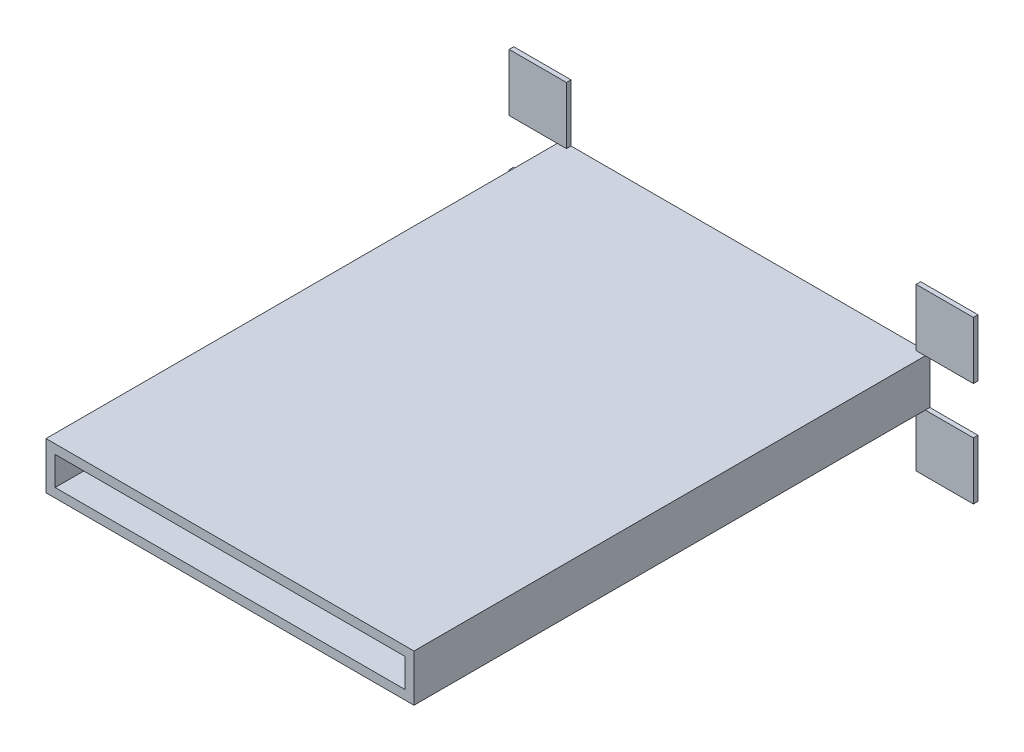
from build123d import *

# Parameters (mm, degrees)
SKETCH1_W           = 64.2
SKETCH1_H           = 8.2
SKETCH1_W_2         = 61
SKETCH1_H_2         = 5
BOSS_EXTRUDE1_DEPTH = 90
SKETCH2_W           = 4
SKETCH2_H           = 8.2
BOSS_EXTRUDE2_DEPTH = 2
BOSS_EXTRUDE4_DEPTH = 8
SKETCH5_W           = 17.2
SKETCH5_H           = 27.6
BOSS_EXTRUDE5_DEPTH = 1.6
CHAMFER3_SIZE       = 11
FILLET1_R           = 3
FILLET2_R           = 2
FILLET3_R           = 3
SKETCH3_W           = 10
SKETCH3_H           = 10
BOSS_EXTRUDE3_DEPTH = 0.8


with BuildPart() as part:
    # Sketch1 → Boss-Extrude1 (new body)
    with BuildSketch(Plane.XY):
        Rectangle(SKETCH1_W, SKETCH1_H)
        Rectangle(SKETCH1_W_2, SKETCH1_H_2, mode=Mode.SUBTRACT)
    extrude(amount=BOSS_EXTRUDE1_DEPTH)

    # Sketch2 → Boss-Extrude2 (add)
    with BuildSketch(Plane(origin=(0, 0, 0), x_dir=(-1, 0, 0), z_dir=(0, 0, -1))):
        Rectangle(SKETCH2_W, SKETCH2_H)
    extrude(amount=-BOSS_EXTRUDE2_DEPTH)

    # Sketch4 → Boss-Extrude4 (add)
    with BuildSketch(Plane.XZ.offset(4.1)):
        Polygon((-7, 52.6), (-7, 26.6), (7, 26.6), (7, 52.6), (8.6, 52.6), (8.6, 25), (-8.6, 25), (-8.6, 52.6), align=None)
    extrude(amount=BOSS_EXTRUDE4_DEPTH)

    # Sketch5 → Boss-Extrude5 (add)
    with BuildSketch(Plane.XZ.offset(12.1)):
        with Locations((0, 38.8)):
            Rectangle(SKETCH5_W, SKETCH5_H)
    extrude(amount=BOSS_EXTRUDE5_DEPTH)

    # Chamfer3
    # the kernel refuses this chamfer: 11 mm, written as the material it adds along each edge
    with BuildSketch(Plane(origin=(8.6, -4.1, 25), x_dir=(0, 0.027495876610586372, -0.9996219169112968), z_dir=(-1, 0, 0))) as chamfer3_piece_1_section:
        Polygon((CHAMFER3_SIZE * 0.999621916911, CHAMFER3_SIZE * 0.0274958766106), (-CHAMFER3_SIZE * 0.0274958766106, CHAMFER3_SIZE * 0.999621916911), (0, 0), align=None)
    chamfer3_piece_1 = extrude(amount=17.2, mode=Mode.PRIVATE)
    chamfer3_piece_1 = split(chamfer3_piece_1, bisect_by=Plane(origin=(0, -13.7, 21.279882352), z_dir=(0, 1, 0)), keep=Keep.TOP, mode=Mode.PRIVATE)
    add(chamfer3_piece_1)

    # Fillet1
    fillet1_edges = [part.edges().sort_by_distance(p)[0] for p in [
        (-8.6, -4.1, 33.3),
        (8.6, -4.1, 33.3),
    ]]
    fillet(fillet1_edges, radius=FILLET1_R)

    # Fillet2
    fillet2_edges = [part.edges().sort_by_distance(p)[0] for p in [
        (2, -2.5, 1),
        (-2, -2.5, 1),
        (-2, 2.5, 1),
        (2, 2.5, 1),
    ]]
    fillet(fillet2_edges, radius=FILLET2_R)

    # Fillet3
    fillet3_edges = [part.edges().sort_by_distance(p)[0] for p in [
        (-9.3, -4.1, 52.6),
        (9.3, -4.1, 52.6),
    ]]
    fillet(fillet3_edges, radius=FILLET3_R)

    # Sketch3 → Boss-Extrude3 (add)
    with BuildSketch(Plane(origin=(0, 0, 0), x_dir=(-1, 0, 0), z_dir=(0, 0, -1))):
        with Locations((-35.5, 9.1)):
            Rectangle(SKETCH3_W, SKETCH3_H)
        with Locations((35.5, 9.1)):
            Rectangle(SKETCH3_W, SKETCH3_H)
        with Locations((35.5, -9.1)):
            Rectangle(SKETCH3_W, SKETCH3_H)
        with Locations((-35.5, -9.1)):
            Rectangle(SKETCH3_W, SKETCH3_H)
    extrude(amount=-BOSS_EXTRUDE3_DEPTH)


solid = part.part
